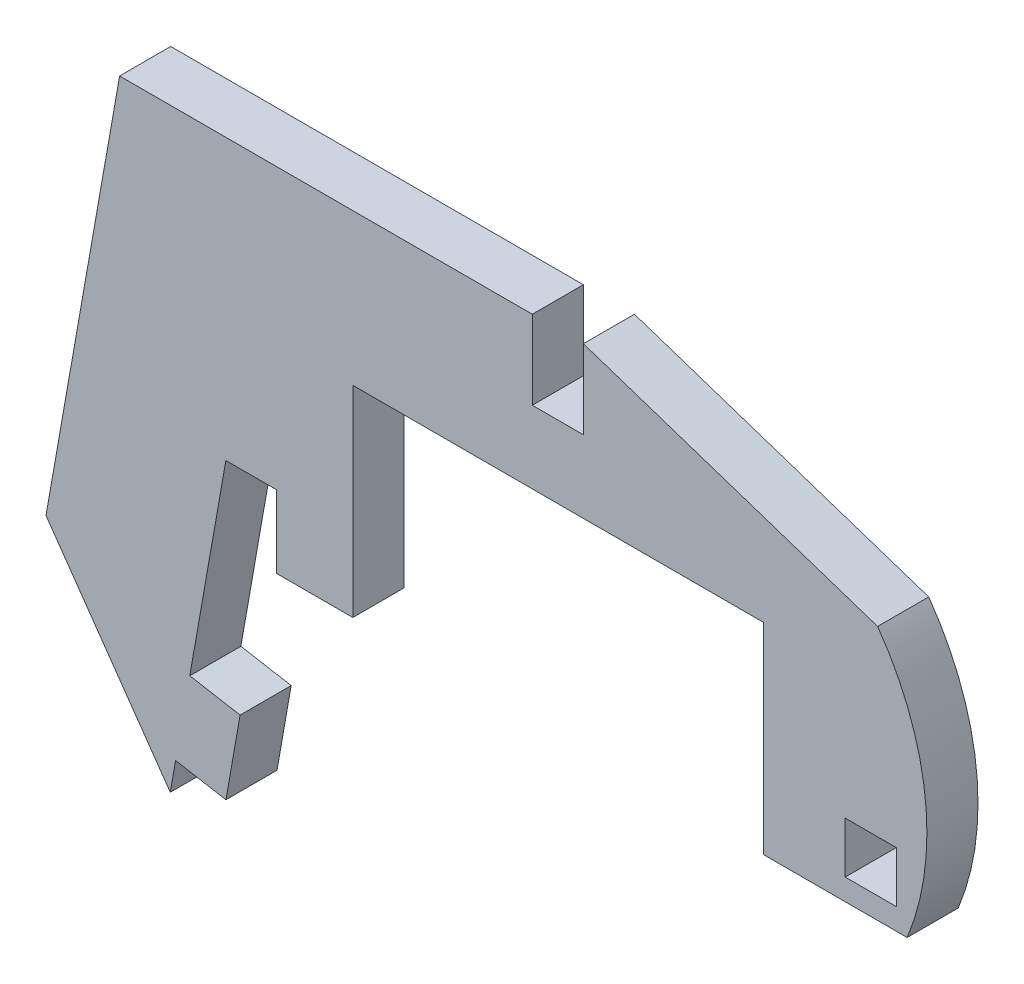
from build123d import *

# Parameters (mm, degrees)
BOSS_EXTRU_1_DEPTH      = 5
ESQUISSE2_W             = 5
ESQUISSE2_H             = 5
ESQUISSE2_H_2           = 7.716636706
ENL_V_MAT_EXTRU_1_DEPTH = 5


with BuildPart() as part:
    # Esquisse1 → Boss.-Extru.1 (new body)
    with BuildSketch(Plane.XY):
        Polygon((0, 0), (0, -19.685), (20, -19.685), (20, 2.315), (-17.629364869, 14.809136706), (-63.027846181, 14.809136706), (-70.234197757, -26.060113977), (-54.01100625, -49.22923259), (-48.80156092, -19.685), (-40.2, -19.685), (-40.2, 0), align=None)
    extrude(amount=BOSS_EXTRU_1_DEPTH)

    # Esquisse2 → Enlèv. mat.-Extru.1 (cut)
    with BuildSketch(Plane(origin=(0, 0, 0), x_dir=(-1, 0, 0), z_dir=(0, 0, -1))):
        with BuildLine():
            Line((-11.174422585, 5.245370234), (-11.997659033, 9.914176137))
            Line((-11.997659033, 9.914176137), (-30.732234233, 6.610765057))
            Line((-30.732234233, 6.610765057), (-25.732815565, -21.742347141))
            Line((-25.732815565, -21.742347141), (-14.065020128, -19.685))
            ThreePointArc((-14.065020128, -19.685), (-15.826974934, -6.847943979), (-11.174422585, 5.245370234))
        make_face()
        with Locations((-10.5, -15.0925)):
            Rectangle(ESQUISSE2_W, ESQUISSE2_H)
        with Locations((20.129364869, 10.950818353)):
            Rectangle(ESQUISSE2_W, ESQUISSE2_H_2)
        Polygon((47.693, -34.096441766), (47.693, -12.5925), (52.628094869, -12.5925), (56.156674173, -32.604067654), align=None)
        Polygon((57.545859594, -40.482529678), (58.935045015, -48.360991702), (54.01100625, -49.22923259), (52.621820829, -41.350770566), align=None)
    extrude(amount=-ENL_V_MAT_EXTRU_1_DEPTH, mode=Mode.SUBTRACT)


solid = part.part
